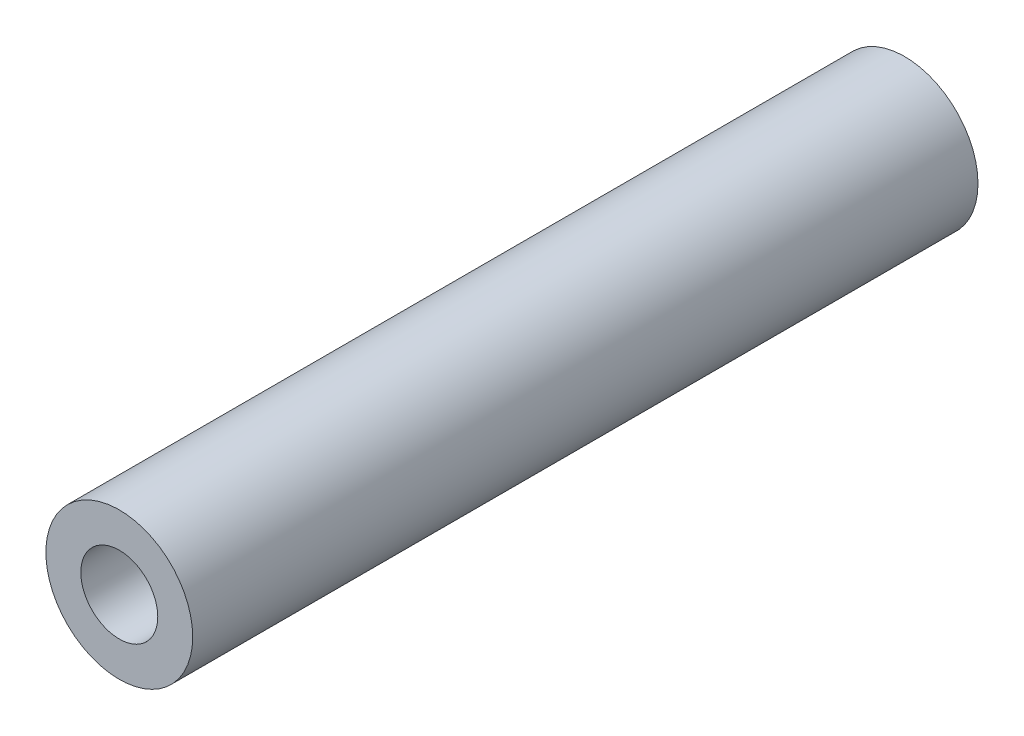
from build123d import *

# Parameters (mm, degrees)
SKETCH1_R           = 4.7498
SKETCH1_R_2         = 2.4892
BOSS_EXTRUDE1_DEPTH = 50.8


with BuildPart() as part:
    # Sketch1 → Boss-Extrude1 (new body)
    with BuildSketch(Plane.XY):
        Circle(SKETCH1_R)
        Circle(SKETCH1_R_2, mode=Mode.SUBTRACT)
    extrude(amount=BOSS_EXTRUDE1_DEPTH)


solid = part.part
